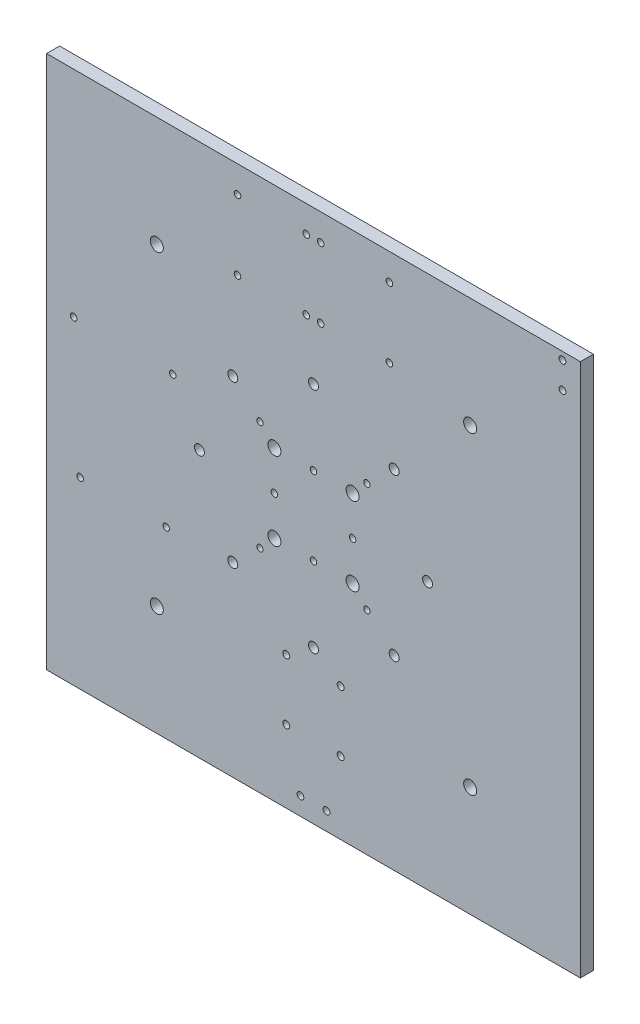
from build123d import *

# Parameters (mm, degrees)
SKETCH1_W           = 260
SKETCH1_H           = 260
SKETCH1_R           = 1.55
SKETCH1_R_2         = 1.5875
SKETCH1_R_3         = 1.6
SKETCH1_R_4         = 1.7
SKETCH1_R_5         = 3.175
SKETCH1_R_6         = 2.415
SKETCH1_R_7         = 1.651
BOSS_EXTRUDE2_DEPTH = 6.35
SKETCH2_R           = 1.5875
CUT_EXTRUDE1_DEPTH  = 184.957393165
SKETCH3_R           = 3.175
CUT_EXTRUDE2_DEPTH  = 184.957393165


with BuildPart() as part:
    # Sketch1 → Boss-Extrude2 (new body)
    with BuildSketch(Plane.XY):
        Rectangle(SKETCH1_W, SKETCH1_H)
        with Locations((-26.035, 26.67)):
            Circle(SKETCH1_R, mode=Mode.SUBTRACT)
        with Locations((-26.035, -26.67)):
            Circle(SKETCH1_R, mode=Mode.SUBTRACT)
        with Locations((26.035, 26.67)):
            Circle(SKETCH1_R, mode=Mode.SUBTRACT)
        with Locations((26.035, -26.67)):
            Circle(SKETCH1_R, mode=Mode.SUBTRACT)
        with Locations((-116.825, 25.402702903)):
            Circle(SKETCH1_R_2, mode=Mode.SUBTRACT)
        with Locations((-113.65, -40.635194695)):
            Circle(SKETCH1_R_2, mode=Mode.SUBTRACT)
        with Locations((-68.565, 25.404805305)):
            Circle(SKETCH1_R_2, mode=Mode.SUBTRACT)
        with Locations((-37, 117)):
            Circle(SKETCH1_R_3, mode=Mode.SUBTRACT)
        with Locations((-37, 83)):
            Circle(SKETCH1_R_3, mode=Mode.SUBTRACT)
        with Locations((-3.5, 117)):
            Circle(SKETCH1_R_3, mode=Mode.SUBTRACT)
        with Locations((-3.5, 83)):
            Circle(SKETCH1_R_3, mode=Mode.SUBTRACT)
        with Locations((3.5, 117)):
            Circle(SKETCH1_R_3, mode=Mode.SUBTRACT)
        with Locations((37, 117)):
            Circle(SKETCH1_R_3, mode=Mode.SUBTRACT)
        with Locations((37, 83)):
            Circle(SKETCH1_R_3, mode=Mode.SUBTRACT)
        with Locations((3.5, 83)):
            Circle(SKETCH1_R_3, mode=Mode.SUBTRACT)
        with Locations((-13.25, -65.25)):
            Circle(SKETCH1_R_4, mode=Mode.SUBTRACT)
        with Locations((13.25, -65.25)):
            Circle(SKETCH1_R_4, mode=Mode.SUBTRACT)
        with Locations((13.25, -94.75)):
            Circle(SKETCH1_R_4, mode=Mode.SUBTRACT)
        with Locations((-13.25, -94.75)):
            Circle(SKETCH1_R_4, mode=Mode.SUBTRACT)
        with Locations((-76.33, 76.33)):
            Circle(SKETCH1_R_5, mode=Mode.SUBTRACT)
        with Locations((0, 55.575)):
            Circle(SKETCH1_R_6, mode=Mode.SUBTRACT)
        with Locations((-55.575, 0)):
            Circle(SKETCH1_R_6, mode=Mode.SUBTRACT)
        with Locations((0, -55.575)):
            Circle(SKETCH1_R_6, mode=Mode.SUBTRACT)
        with Locations((55.575, 0)):
            Circle(SKETCH1_R_6, mode=Mode.SUBTRACT)
        with Locations((-39.297459364, 39.297459364)):
            Circle(SKETCH1_R_6, mode=Mode.SUBTRACT)
        with Locations((39.297459364, 39.297459364)):
            Circle(SKETCH1_R_6, mode=Mode.SUBTRACT)
        with Locations((39.297459364, -39.297459364)):
            Circle(SKETCH1_R_6, mode=Mode.SUBTRACT)
        with Locations((-39.297459364, -39.297459364)):
            Circle(SKETCH1_R_6, mode=Mode.SUBTRACT)
        with Locations((76.33, 76.33)):
            Circle(SKETCH1_R_5, mode=Mode.SUBTRACT)
        with Locations((76.33, -76.33)):
            Circle(SKETCH1_R_5, mode=Mode.SUBTRACT)
        with Locations((-76.33, -76.33)):
            Circle(SKETCH1_R_5, mode=Mode.SUBTRACT)
        with Locations((-71.74, -40.635194695)):
            Circle(SKETCH1_R_2, mode=Mode.SUBTRACT)
        with Locations((6.35, -121.3)):
            Circle(SKETCH1_R_7, mode=Mode.SUBTRACT)
        with Locations((-6.35, -121.3)):
            Circle(SKETCH1_R_7, mode=Mode.SUBTRACT)
        with Locations((121.3, 126.35)):
            Circle(SKETCH1_R_7, mode=Mode.SUBTRACT)
        with Locations((121.3, 113.65)):
            Circle(SKETCH1_R_7, mode=Mode.SUBTRACT)
    extrude(amount=BOSS_EXTRUDE2_DEPTH)

    # Sketch2 → Cut-Extrude1 (cut, through all)
    with BuildSketch(Plane(origin=(0, 0, 0), x_dir=(-1, 0, 0), z_dir=(0, 0, -1))):
        with Locations((0, 19.05)):
            Circle(SKETCH2_R)
        with Locations((-19.05, 0)):
            Circle(SKETCH2_R)
        with Locations((19.05, 0)):
            Circle(SKETCH2_R)
        with Locations((0, -19.05)):
            Circle(SKETCH2_R)
    extrude(amount=-CUT_EXTRUDE1_DEPTH, mode=Mode.SUBTRACT)

    # Sketch3 → Cut-Extrude2 (cut, through all)
    with BuildSketch(Plane(origin=(0, 0, 0), x_dir=(-1, 0, 0), z_dir=(0, 0, -1))):
        with Locations((-19.05, 19.05)):
            Circle(SKETCH3_R)
        with Locations((19.05, 19.05)):
            Circle(SKETCH3_R)
        with Locations((-19.05, -19.05)):
            Circle(SKETCH3_R)
        with Locations((19.05, -19.05)):
            Circle(SKETCH3_R)
    extrude(amount=-CUT_EXTRUDE2_DEPTH, mode=Mode.SUBTRACT)


solid = part.part
